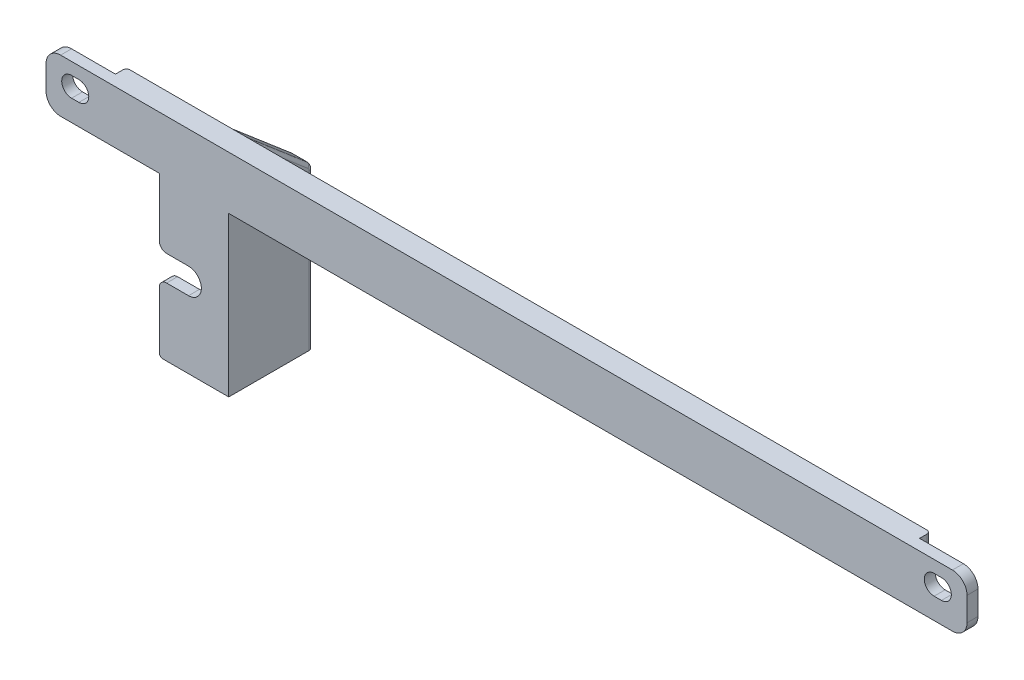
from build123d import *

# Parameters (mm, degrees)
BOSS_EXTRUDE1_DEPTH = 3
BOSS_EXTRUDE2_DEPTH = 20
SKETCH7_W           = 220
SKETCH7_H           = 14.5
BOSS_EXTRUDE3_DEPTH = 3
BOSS_EXTRUDE4_DEPTH = 6
CUT_EXTRUDE1_DEPTH  = 257.759128367
FILLET1_R           = 4
FILLET2_R           = 2
FILLET3_R           = 1


with BuildPart() as part:
    # Sketch1 → Boss-Extrude1 (new body)
    with BuildSketch(Plane.XY):
        Polygon((0, 0), (0, 14.5), (252, 14.5), (252, 0), (50, 0), (50, -43.5), (31, -43.5), (31, 0), align=None)
        with BuildLine():
            Line((245, 5.8), (243, 5.8))
            ThreePointArc((243, 5.8), (240.3, 8.5), (243, 11.2))
            Line((243, 11.2), (245, 11.2))
            ThreePointArc((245, 11.2), (247.7, 8.5), (245, 5.8))
        make_face(mode=Mode.SUBTRACT)
        with BuildLine():
            Line((7, 11.2), (9, 11.2))
            ThreePointArc((9, 11.2), (11.7, 8.5), (9, 5.8))
            Line((9, 5.8), (7, 5.8))
            ThreePointArc((7, 5.8), (4.3, 8.5), (7, 11.2))
        make_face(mode=Mode.SUBTRACT)
    extrude(amount=-BOSS_EXTRUDE1_DEPTH)

    # Sketch6 → Boss-Extrude2 (add)
    with BuildSketch(Plane(origin=(0, 0, -3), x_dir=(-1, 0, 0), z_dir=(0, 0, -1))):
        Polygon((-31, -43.5), (-31, -37.5), (-44, -37.5), (-44, 0), (-50, 0), (-50, -43.5), align=None)
    extrude(amount=BOSS_EXTRUDE2_DEPTH)

    # Sketch7 → Boss-Extrude3 (add)
    with BuildSketch(Plane(origin=(0, 0, -3), x_dir=(-1, 0, 0), z_dir=(0, 0, -1))):
        with Locations((-126, 7.25)):
            Rectangle(SKETCH7_W, SKETCH7_H)
    extrude(amount=BOSS_EXTRUDE3_DEPTH)

    # Sketch8 → Boss-Extrude4 (add)
    with BuildSketch(Plane.ZY.offset(-44)):
        Polygon((-23, 0), (-6, 14.5), (-6, 0), align=None)
    extrude(amount=-BOSS_EXTRUDE4_DEPTH)

    # Sketch3 → Cut-Extrude1 (cut, through all)
    with BuildSketch(Plane.XY):
        with BuildLine():
            Line((39, -18), (31, -18))
            Line((31, -18), (31, -25))
            Line((31, -25), (39, -25))
            ThreePointArc((39, -25), (42.5, -21.5), (39, -18))
        make_face()
    extrude(amount=-CUT_EXTRUDE1_DEPTH, mode=Mode.SUBTRACT)

    # Fillet1
    fillet1_edges = [part.edges().sort_by_distance(p)[0] for p in [
        (0, 0, -1.5),
        (0, 14.5, -1.5),
        (252, 0, -1.5),
        (252, 14.5, -1.5),
    ]]
    fillet(fillet1_edges, radius=FILLET1_R)

    # Fillet2
    fillet2_edges = [part.edges().sort_by_distance(p)[0] for p in [
        (47, 0, -23),
        (31, -18, -1.5),
        (31, -25, -1.5),
    ]]
    fillet(fillet2_edges, radius=FILLET2_R)

    # Fillet3
    fillet3_edges = [part.edges().sort_by_distance(p)[0] for p in [
        (44, 7.549427895, -14.148946606),
        (44, -0.084893987, -22.816010246),
        (50, 7.549427895, -14.148946606),
        (50, -0.084893987, -22.816010246),
        (37.5, 0, -3),
        (44, -37.5, -13),
        (31, -37.5, -13),
        (31, -43.5, -11.5),
        (37.5, -37.5, -23),
        (40.5, -43.5, -23),
        (31, -40.5, -23),
        (44, -19.211406057, -23),
        (50, -22.211406057, -23),
        (236, 7.25, -6),
        (16, 7.25, -6),
    ]]
    fillet(fillet3_edges, radius=FILLET3_R)


solid = part.part
